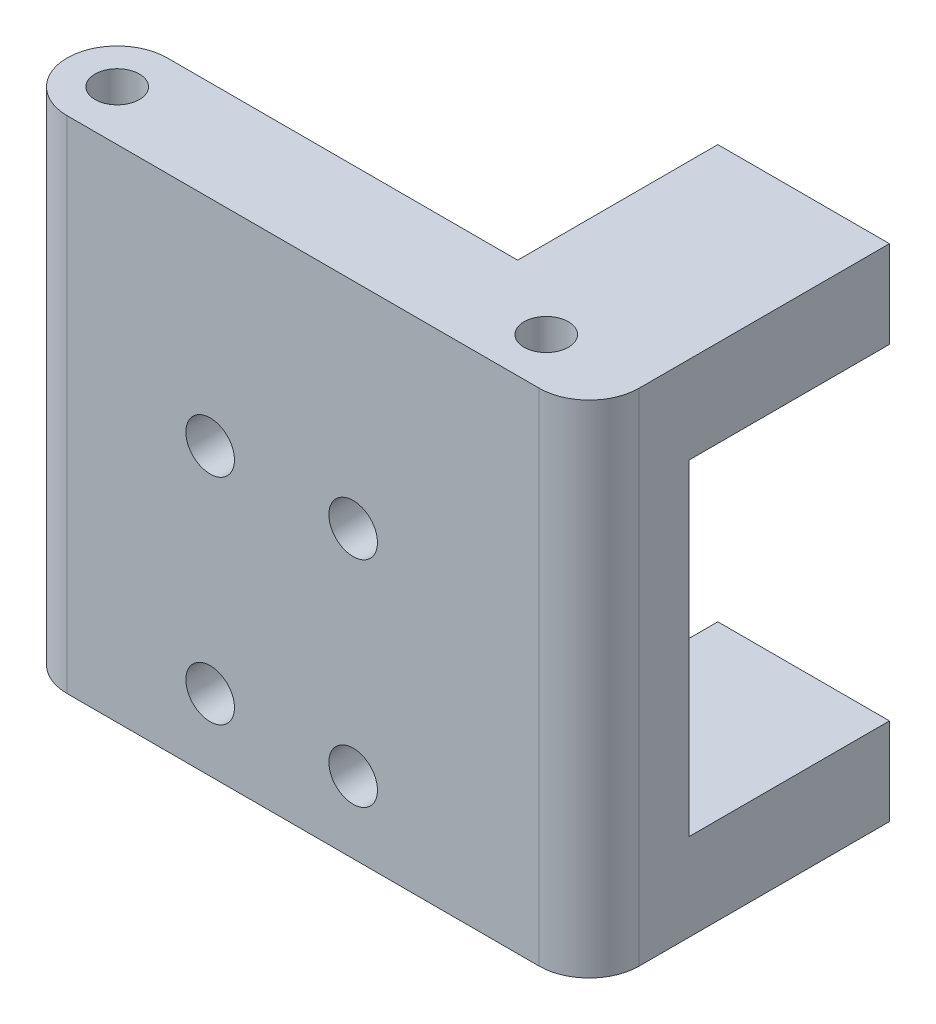
from build123d import *

# Parameters (mm, degrees)
SKIZZE1_W                                            = 40
SKIZZE1_H                                            = 7
AUFSATZ_LINEAR_AUSTRAGEN1_DEPTH                      = 35
SKIZZE2_W                                            = 12
SKIZZE2_H                                            = 6.1
SKIZZE2_R                                            = 0.6
AUFSATZ_LINEAR_AUSTRAGEN2_DEPTH                      = 14
FORMSENKUNG_F_R_M3_SENKSCHRAUBE_MIT_SCHL_D           = 3.4
FORMSENKUNG_F_R_M3_SENKSCHRAUBE_MIT_SCHL_CSINK_D     = 6.3
FORMSENKUNG_F_R_M3_SENKSCHRAUBE_MIT_SCHL_CSINK_ANGLE = 90
VERRUNDUNG1_R                                        = 3.5
SCHNITT_LINEAR_AUSTRAGEN1_DEPTH                      = 45.648628198
SCHNITT_LINEAR_AUSTRAGEN2_DEPTH                      = 2


with BuildPart() as part:
    # Skizze1 → Aufsatz-Linear austragen1 (new body)
    with BuildSketch(Plane(origin=(0, 0, 0), x_dir=(1, 0, 0), z_dir=(0, 1, 0))):
        with Locations((1.5, 0)):
            Rectangle(SKIZZE1_W, SKIZZE1_H)
    extrude(amount=AUFSATZ_LINEAR_AUSTRAGEN1_DEPTH)

    # Skizze2 → Aufsatz-Linear austragen2 (add)
    # profile 1 of 2: a face of its own
    with BuildSketch(Plane(origin=(0, 0, -3.5), x_dir=(-1, 0, 0), z_dir=(0, 0, -1))):
        with Locations((-15.5, 31.95)):
            Rectangle(SKIZZE2_W, SKIZZE2_H)
        with Locations((-15.5, 31.75)):
            Circle(SKIZZE2_R, mode=Mode.SUBTRACT)
    # profile 2 of 2: a face of its own
    with BuildSketch(Plane(origin=(0, 0, -3.5), x_dir=(-1, 0, 0), z_dir=(0, 0, -1))):
        with Locations((-15.5, 3.05)):
            Rectangle(SKIZZE2_W, SKIZZE2_H)
        with Locations((-15.5, 3.25)):
            Circle(SKIZZE2_R, mode=Mode.SUBTRACT)
    extrude(amount=AUFSATZ_LINEAR_AUSTRAGEN2_DEPTH)

    # Formsenkung für M3 Senkschraube mit Schlitz/Kreuzschlitz1 (through all)
    with Locations(Plane(origin=(0, 0, -3.5), x_dir=(-1, 0, 0), z_dir=(0, 0, -1))):
        with Locations((-5, 20), (5, 20), (5, 5), (-5, 5)):
            CounterSinkHole(FORMSENKUNG_F_R_M3_SENKSCHRAUBE_MIT_SCHL_D / 2, FORMSENKUNG_F_R_M3_SENKSCHRAUBE_MIT_SCHL_CSINK_D / 2, counter_sink_angle=FORMSENKUNG_F_R_M3_SENKSCHRAUBE_MIT_SCHL_CSINK_ANGLE)

    # Verrundung1
    verrundung1_edges = [part.edges().sort_by_distance(p)[0] for p in [
        (21.5, 17.5, 3.5),
        (-18.5, 17.5, 3.5),
        (-18.5, 17.5, -3.5),
    ]]
    fillet(verrundung1_edges, radius=VERRUNDUNG1_R - 0.0001)  # a hair under: the kernel refuses the full size

    # Skizze1<5> → Schnitt-Linear austragen1 (cut, through all)
    with BuildSketch(Plane(origin=(0, 0, 0), x_dir=(1, 0, 0), z_dir=(0, 1, 0))):
        with BuildLine():
            ThreePointArc((13.45, 0), (15, -1.55), (16.55, 0))
            Line((16.55, 0), (13.45, 0))
        make_face()
        with BuildLine():
            Line((13.45, 0), (16.55, 0))
            ThreePointArc((16.55, 0), (15, 1.55), (13.45, 0))
        make_face()
        with BuildLine():
            ThreePointArc((-16.55, 0), (-15, -1.55), (-13.45, 0))
            Line((-13.45, 0), (-16.55, 0))
        make_face()
        with BuildLine():
            Line((-16.55, 0), (-13.45, 0))
            ThreePointArc((-13.45, 0), (-15, 1.55), (-16.55, 0))
        make_face()
    extrude(amount=SCHNITT_LINEAR_AUSTRAGEN1_DEPTH, mode=Mode.SUBTRACT)

    # Skizze1<7> → Schnitt-Linear austragen2 (cut)
    with BuildSketch(Plane(origin=(0, 0, 0), x_dir=(1, 0, 0), z_dir=(0, 1, 0))):
        with BuildLine():
            ThreePointArc((-2.4, 0), (0, -2.4), (2.4, 0))
            Line((2.4, 0), (-2.4, 0))
        make_face()
        with BuildLine():
            Line((-2.4, 0), (2.4, 0))
            ThreePointArc((2.4, 0), (0, 2.4), (-2.4, 0))
        make_face()
    extrude(amount=SCHNITT_LINEAR_AUSTRAGEN2_DEPTH, mode=Mode.SUBTRACT)


solid = part.part
